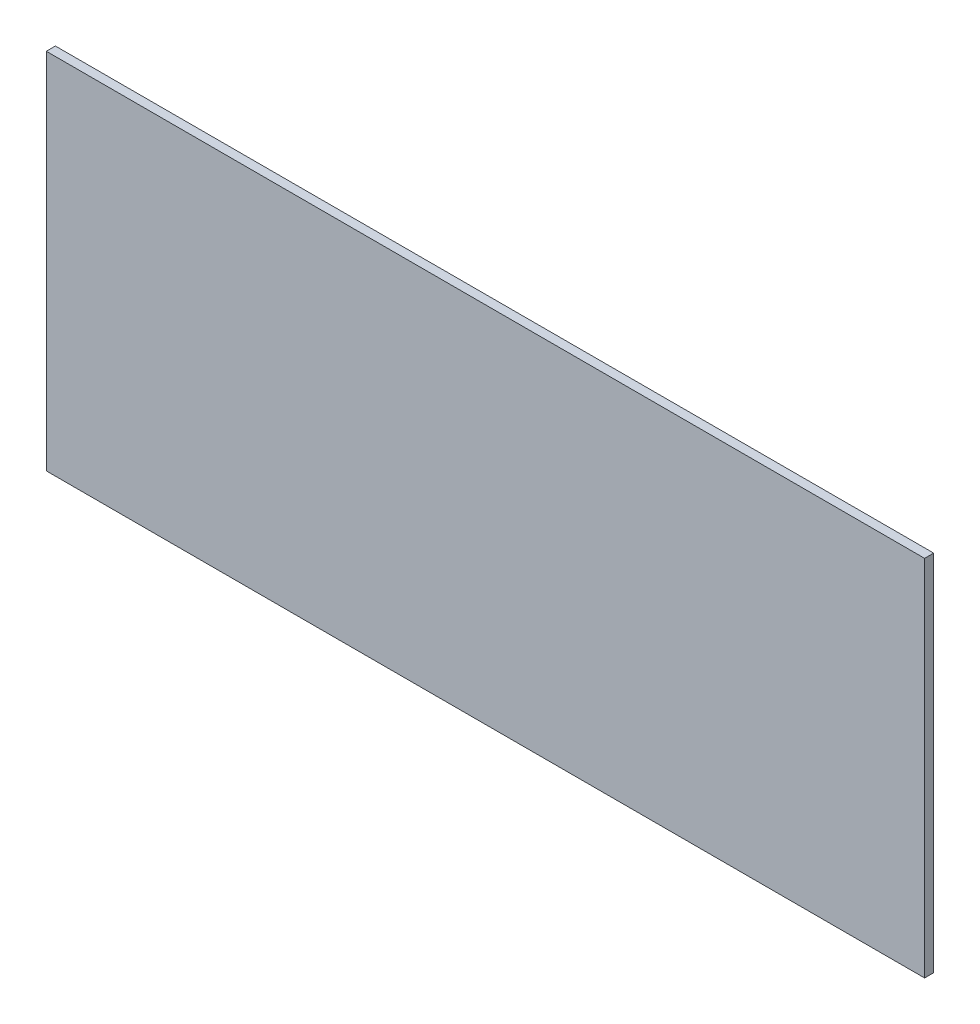
from build123d import *

# Parameters (mm, degrees)
SKETCH1_W           = 290
SKETCH1_H           = 120
BOSS_EXTRUDE1_DEPTH = 3


with BuildPart() as part:
    # Sketch1 → Boss-Extrude1 (new body)
    with BuildSketch(Plane.XY):
        Rectangle(SKETCH1_W, SKETCH1_H)
    extrude(amount=BOSS_EXTRUDE1_DEPTH)


solid = part.part
